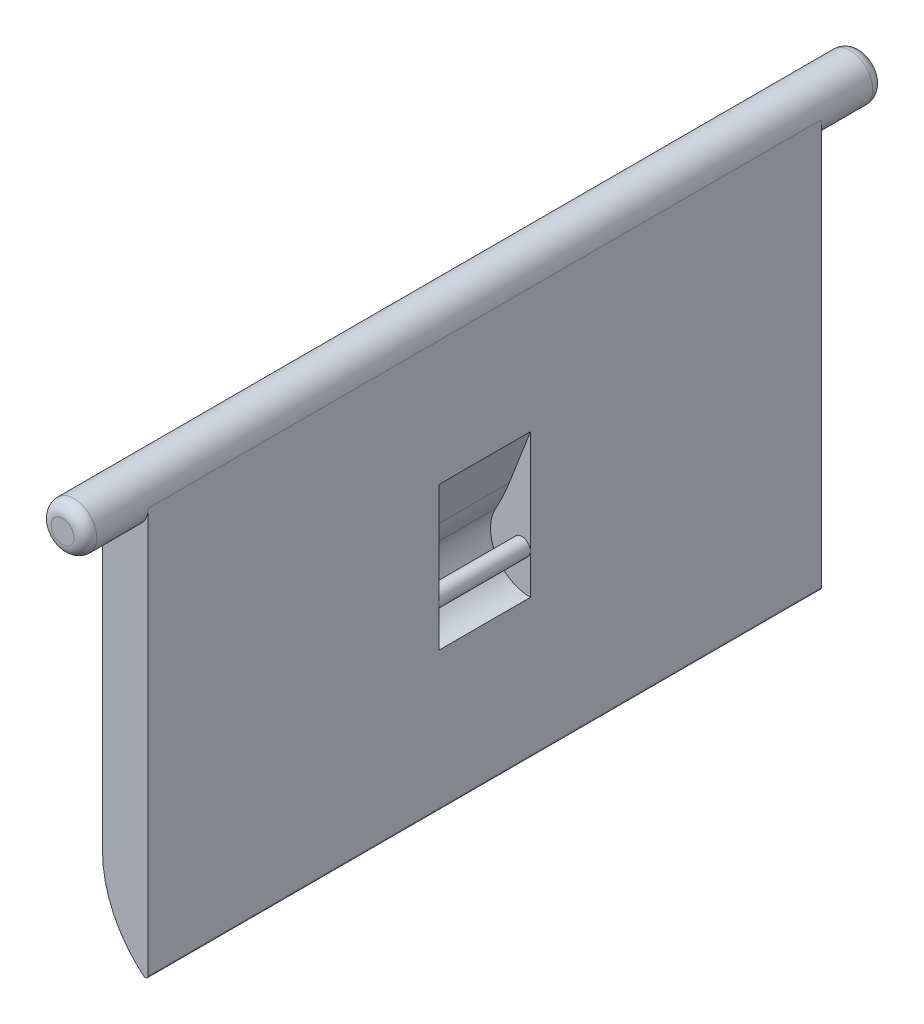
from build123d import *

# Parameters (mm, degrees)
BOSS_EXTRUDE1_DEPTH = 29.5
SKETCH3_4_R         = 2
BOSS_EXTRUDE2_DEPTH = 35
FILLET1_R           = 1
FILLET2_R           = 0.25
SKETCH4_R           = 3.5
CUT_EXTRUDE1_DEPTH  = 4
SKETCH5_R           = 0.75
BOSS_EXTRUDE3_DEPTH = 5
FILLET3_R           = 20


with BuildPart() as part:
    # Sketch3 → Boss-Extrude1 (new, symmetric)
    with BuildSketch(Plane.XY):
        with BuildLine():
            Line((2, -36), (2, 0))
            ThreePointArc((2, 0), (0, -2), (-2, 0))
            Line((-2, 0), (-2, -28))
            ThreePointArc((-2, -28), (-0.94427191, -32.472135955), (2, -36))
        make_face()
    extrude(amount=BOSS_EXTRUDE1_DEPTH, both=True)

    # Sketch3<4> → Boss-Extrude2 (add, symmetric)
    with BuildSketch(Plane.XY):
        Circle(SKETCH3_4_R)
    extrude(amount=BOSS_EXTRUDE2_DEPTH, both=True)

    # Fillet1
    fillet1_edges = [part.edges().sort_by_distance(p)[0] for p in [
        (-2, 0, -35),
        (-2, 0, 35),
    ]]
    fillet(fillet1_edges, radius=FILLET1_R)

    # Fillet2
    fillet2_edges = [part.edges().sort_by_distance(p)[0] for p in [
        (2, -36, 0),
    ]]
    fillet(fillet2_edges, radius=FILLET2_R)

    # Sketch4 → Cut-Extrude1 (cut, symmetric)
    with BuildSketch(Plane.XY):
        with Locations((2, -20)):
            Circle(SKETCH4_R)
    extrude(amount=CUT_EXTRUDE1_DEPTH, both=True, mode=Mode.SUBTRACT)

    # Sketch5 → Boss-Extrude3 (add, symmetric)
    with BuildSketch(Plane.XY):
        with Locations((1.25, -20)):
            Circle(SKETCH5_R)
    extrude(amount=BOSS_EXTRUDE3_DEPTH, both=True)

    # Chamfer1
    # the kernel refuses this chamfer: 10 mm, written as the material it takes off along each edge
    with BuildSketch(Plane(origin=(2, -16.5, -4), x_dir=(0.024228479876225433, 0.9997064472948483, 0), z_dir=(0, 0, 1))) as chamfer1_piece_1:
        with BuildLine():
            Line((5.944098049, 0), (-1.587763168, 2.698932243))
            Line((-1.587763168, 2.698932243), (-1.718492524, 2.54757229))
            ThreePointArc((-1.718492524, 2.54757229), (-0.583435154, 1.461046885), (-0.199941289, -0.004845696))
            Line((-0.199941289, -0.004845696), (0.004845696, -0.199941289))
            ThreePointArc((0.004845696, -0.199941289), (2.975150071, -0.127954198), (5.948943745, -0.199941289))
            Line((5.948943745, -0.199941289), (5.944098049, 0))
        make_face()
    extrude(amount=8, mode=Mode.SUBTRACT)

    # Fillet3
    fillet3_edges = [part.edges().sort_by_distance(p)[0] for p in [
        (-0.592592593, -17.648731481, 0),
    ]]
    fillet(fillet3_edges, radius=FILLET3_R)


solid = part.part
